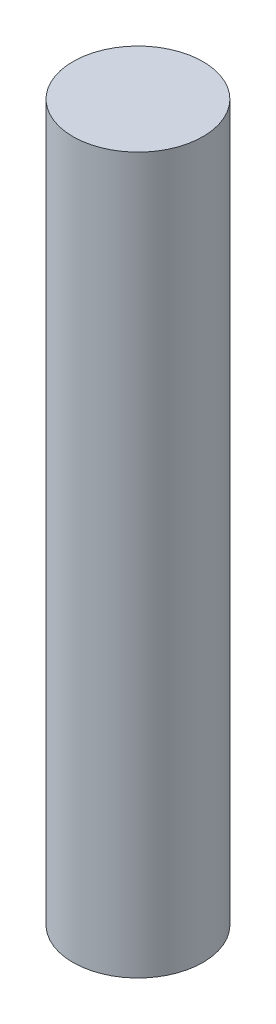
from build123d import *

# Parameters (mm, degrees)
ESQUISSE1_R        = 1
BOSS_EXTRU_2_DEPTH = 11


with BuildPart() as part:
    # Esquisse1 → Boss.-Extru.2 (new body)
    with BuildSketch(Plane(origin=(0, 0, 0), x_dir=(1, 0, 0), z_dir=(0, 1, 0))):
        Circle(ESQUISSE1_R)
    extrude(amount=BOSS_EXTRU_2_DEPTH)


solid = part.part
